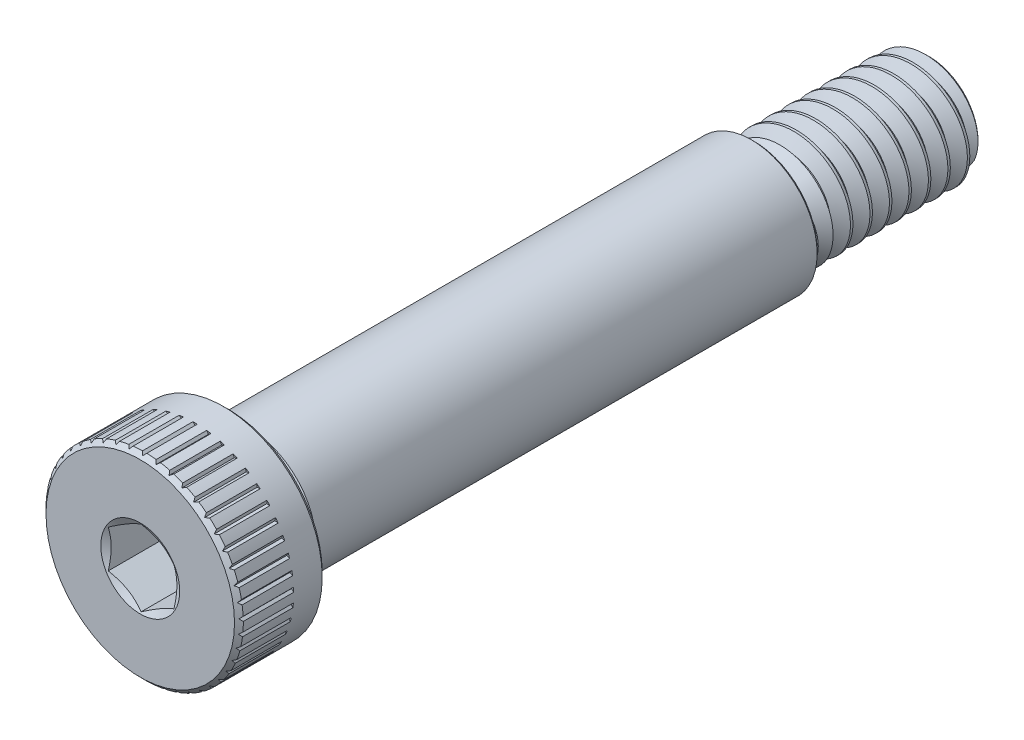
from build123d import *

# Parameters (mm, degrees)
CUT_EXTRUDE1_DEPTH = 3.96875
CUT_SWEEP2_PITCH   = 1.411111111
CUT_EXTRUDE4_START = 40.48125
CUT_EXTRUDE4_DEPTH = 6.102396499
CIRPATTERN1_COUNT  = 45


# Read off the part's stored shape, not the designer's step: DeleteFace3
with BuildPart() as part:
    # Sketch2 → Revolve2 (revolve)
    with BuildSketch(Plane(origin=(0, 0, 0), x_dir=(0, 0, -1), z_dir=(1, 0, 0)), mode=Mode.PRIVATE) as revolve2_sk:
        with BuildLine():
            Line((-44.45, 0), (-44.45, 6.82625))
            Line((-44.45, 6.82625), (-44.1325, 7.14375))
            Line((-44.1325, 7.14375), (-38.4175, 7.14375))
            Line((-38.4175, 7.14375), (-38.1, 6.82625))
            Line((-38.1, 6.82625), (-38.1, 4.7625))
            Line((-38.1, 4.7625), (-37.983786934, 4.328786934))
            Line((-37.983786934, 4.328786934), (-36.749064712, 4.328786934))
            Line((-36.749064712, 4.328786934), (-36.498660357, 4.7625))
            Line((-36.498660357, 4.7625), (-0.19685, 4.7625))
            Line((-0.19685, 4.7625), (0, 4.56565))
            Line((0, 4.56565), (0, 3.159405085))
            ThreePointArc((0, 3.159405085), (0.051908665, 3.034086483), (0.177227267, 2.982177818))
            Line((0.177227267, 2.982177818), (0.882782822, 2.982177818))
            Line((0.882782822, 2.982177818), (1.34579004, 3.9751))
            Line((1.34579004, 3.9751), (11.994444444, 3.9751))
            Line((11.994444444, 3.9751), (12.7, 3.269544444))
            Line((12.7, 3.269544444), (12.7, 0))
            Line((12.7, 0), (-44.45, 0))
        make_face()
    revolve(revolve2_sk.sketch.rotate(Axis((0, 0, 44.45), (0, 0, -1)), 90), axis=Axis((0, 0, 44.45), (0, 0, -1)))

    # Sketch3 → Cut-Extrude1 (cut)
    with BuildSketch(Plane.XY.offset(44.45)):
        Polygon((2.38125, 1.374815329), (0, 2.749630657), (-2.38125, 1.374815329), (-2.38125, -1.374815329), (0, -2.749630657), (2.38125, -1.374815329), align=None)
    extrude(amount=-CUT_EXTRUDE1_DEPTH, mode=Mode.SUBTRACT)

    # Cut-Extrude2 cone 1 section (through the dimple's axis) → Cut-Extrude2 (revolve, cut)
    with BuildSketch(Plane(origin=(0, 0, 44.45), x_dir=(0, -1, 0), z_dir=(1, 0, 0))):
        Polygon((0, 0), (2.8575, 0), (0, 1.649778394), align=None)
    revolve(axis=Axis((0, 0, 44.45), (0, 0, -1)), mode=Mode.SUBTRACT)

    # Cut-Extrude3 cone 1 section (through the dimple's axis) → Cut-Extrude3 (revolve, cut)
    with BuildSketch(Plane(origin=(0, 0, 40.48125), x_dir=(0, -1, 0), z_dir=(1, 0, 0))):
        Polygon((0, 0), (2.38125, 0), (0, 0.20833238), align=None)
    revolve(axis=Axis((0, 0, 40.48125), (0, 0, -1)), mode=Mode.SUBTRACT)


with BuildPart() as body_2:
    # Split1: the piece on the far side of the plane
    add(part.part)
    split(bisect_by=Plane.XY, keep=Keep.BOTTOM)

    # DeleteFace3 outline → DeleteFace3 (revolve)
    with BuildSketch(Plane.XZ):
        with BuildLine():
            Line((2.982177818, -0.882782822), (3.9751, -1.34579004))
            Line((3.9751, -1.34579004), (3.9751, 0))
            Line((3.9751, 0), (3.159405085, 0))
            ThreePointArc((3.159405085, 0), (3.034086483, -0.051908665), (2.982177818, -0.177227267))
            Line((2.982177818, -0.177227267), (2.982177818, -0.882782822))
        make_face()
        Polygon((3.9751, -12.7), (3.9751, -11.994444444), (3.269544444, -12.7), align=None)
    revolve(axis=Axis((0, 0, 0), (0, 0, 1)))

    # Cut-Sweep2: the profile of Sketch8 screwed along a right-hand helix of 10 turns, 8 arcs to a turn; built about Z, then put on its axis
    cut_sweep2_z = Axis((0, 0, 0), (0, 0, 1))
    cut_sweep2_corners = [(3.058556448, 0, -0.529166667), (3.058556448, 0, -0.705555556), (4.051478629, 0, -1.278819444), (4.051478629, 0, 0.044097222)]
    with BuildLine(mode=Mode.PRIVATE) as cut_sweep2_profile:
        Line(cut_sweep2_corners[0], cut_sweep2_corners[1])
        Line(cut_sweep2_corners[1], cut_sweep2_corners[2])
        Line(cut_sweep2_corners[2], cut_sweep2_corners[3])
        Line(cut_sweep2_corners[3], cut_sweep2_corners[0])
    cut_sweep2_cap = Face(cut_sweep2_profile.wire())
    cut_sweep2_turn_angles = [0, 22.5, 45, 67.5, 90, 112.5, 135, 157.5, 180, 202.5, 225, 247.5, 270, 292.5, 315, 337.5, 360]
    cut_sweep2_turn_weights = [1, 0.9238795325112867, 1, 0.9238795325112867, 1, 0.9238795325112867, 1, 0.9238795325112867, 1, 0.9238795325112867, 1, 0.9238795325112867, 1, 0.9238795325112867, 1, 0.9238795325112867, 1]
    cut_sweep2_turn_rails = [Edge.make_bspline([Vector(p[0], p[1], 0).rotate(cut_sweep2_z, cut_sweep2_turn_angles[k]) / cut_sweep2_turn_weights[k] + Vector(0, 0, p[2] + CUT_SWEEP2_PITCH * cut_sweep2_turn_angles[k] / 360) for k in range(17)], [0, 0, 0, 1, 1, 2, 2, 3, 3, 4, 4, 5, 5, 6, 6, 7, 7, 8, 8, 8], 2, cut_sweep2_turn_weights) for p in cut_sweep2_corners]
    cut_sweep2_turn_sides = [Face.make_surface_from_curves(cut_sweep2_turn_rails[p[0]], cut_sweep2_turn_rails[p[1]]) for p in [(0, 1), (1, 2), (2, 3), (3, 0)]]
    cut_sweep2 = Plane(origin=(0, 0, -12.7), x_dir=(0, 1, 0), z_dir=(0, 0, 1)) * Solid(Shell([*[p.moved(Location((0, 0, CUT_SWEEP2_PITCH * i))) for i in range(10) for p in cut_sweep2_turn_sides], cut_sweep2_cap, cut_sweep2_cap.rotate(cut_sweep2_z, 3600).moved(Location((0, 0, CUT_SWEEP2_PITCH * 3600 / 360)))]))
    add(cut_sweep2, mode=Mode.SUBTRACT)

    # Sketch9 → Cut-Revolve3 (revolve, cut)
    with BuildSketch(Plane(origin=(0, 0, 0), x_dir=(0, 0, -1), z_dir=(1, 0, 0)), mode=Mode.PRIVATE) as cut_revolve3_sk:
        Polygon((11.454328224, 4.7625), (12.7, 3.516828224), (12.7, 4.7625), align=None)
        with BuildLine():
            Line((0, 4.7625), (0, 3.159405085))
            ThreePointArc((0, 3.159405085), (0.051908665, 3.034086483), (0.177227267, 2.982177818))
            Line((0.177227267, 2.982177818), (0.882782822, 2.982177818))
            Line((0.882782822, 2.982177818), (2.663105004, 4.7625))
            Line((2.663105004, 4.7625), (0, 4.7625))
        make_face()
    revolve(cut_revolve3_sk.sketch.rotate(Axis((0, 0, 44.45), (0, 0, -1)), 90), axis=Axis((0, 0, 44.45), (0, 0, -1)), mode=Mode.SUBTRACT)


with BuildPart() as part_1:
    add(part.part)

    # Split1
    split(bisect_by=Plane.XY, keep=Keep.TOP)

    # Combine1: union body 2
    add(body_2.part)

    # Sketch10 → Cut-Extrude4 (cut, through all)
    with BuildSketch(Plane.XY.offset(CUT_EXTRUDE4_START)):
        Polygon((-0.15875, 7.14375), (0, 6.985), (0.15875, 7.14375), align=None)
    cut_extrude4 = extrude(amount=CUT_EXTRUDE4_DEPTH, mode=Mode.SUBTRACT)

    # CirPattern1: Cut-Extrude4 ×45 about axis
    cirpattern1_axis = Axis((0, 0, 0), (0, 0, 1))
    for i in range(1, CIRPATTERN1_COUNT):
        add(cut_extrude4.rotate(cirpattern1_axis, i * 360 / CIRPATTERN1_COUNT), mode=Mode.SUBTRACT)


solid = part_1.part
